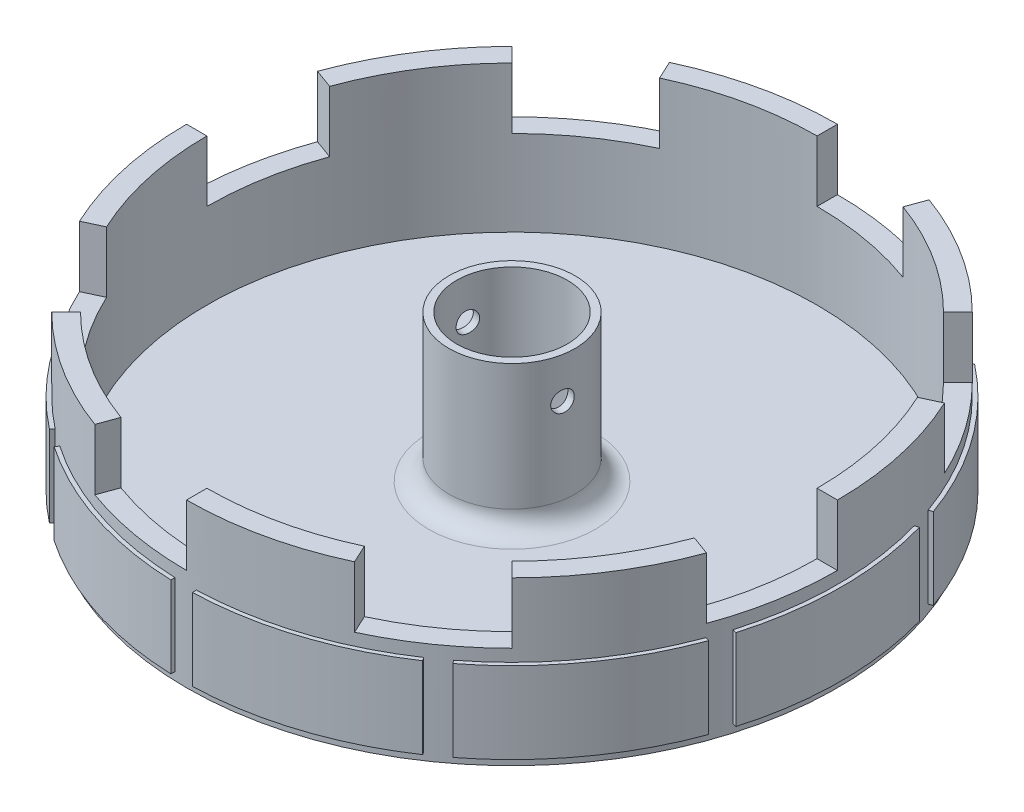
from build123d import *

# Parameters (mm, degrees)
SKETCH2_R           = 101.6
BOSS_EXTRUDE1_DEPTH = 50.8
SKETCH3_R           = 95.25
SKETCH3_R_2         = 19.685
CUT_EXTRUDE1_DEPTH  = 45.72
SKETCH4_R           = 17.272
CUT_EXTRUDE2_DEPTH  = 153.4
CUT_EXTRUDE3_START  = -19.05
CUT_EXTRUDE3_DEPTH  = 19.05
CIRPATTERN1_COUNT   = 8
WRAP1_START         = 2.54
WRAP1_DEPTH         = 25.4
CIRPATTERN2_COUNT   = 10
SKETCH9_R           = 3.175
CUT_EXTRUDE5_DEPTH  = 170.748495522
FILLET1_R           = 6.35


# Read off the part's stored shape, not the designer's step: Wrap1
with BuildPart() as part:
    # Sketch2 → Boss-Extrude1 (new body)
    with BuildSketch(Plane(origin=(0, 0, 0), x_dir=(1, 0, 0), z_dir=(0, 1, 0))):
        with Locations(Location((0, 0, 0), (0, 0, 270))):
            Circle(SKETCH2_R)
    extrude(amount=BOSS_EXTRUDE1_DEPTH)

    # Sketch3 → Cut-Extrude1 (cut)
    with BuildSketch(Plane(origin=(0, 50.8, 0), x_dir=(1, 0, 0), z_dir=(0, 1, 0))):
        with Locations(Location((0, 0, 0), (0, 0, 270))):
            Circle(SKETCH3_R)
        with Locations(Location((0, 0, 0), (0, 0, 270))):
            Circle(SKETCH3_R_2, mode=Mode.SUBTRACT)
    extrude(amount=-CUT_EXTRUDE1_DEPTH, mode=Mode.SUBTRACT)

    # Sketch4 → Cut-Extrude2 (cut, through all)
    with BuildSketch(Plane(origin=(0, 50.8, 0), x_dir=(1, 0, 0), z_dir=(0, 1, 0))):
        with Locations(Location((0, 0, 0), (0, 0, 270))):
            Circle(SKETCH4_R)
    extrude(amount=-CUT_EXTRUDE2_DEPTH, mode=Mode.SUBTRACT)

    # Sketch5 → Cut-Extrude3 (cut)
    with BuildSketch(Plane(origin=(0, 50.8, 0), x_dir=(1, 0, 0), z_dir=(0, 1, 0)).offset(CUT_EXTRUDE3_START)):
        with BuildLine():
            Line((0, 101.6), (0, 94.154505037))
            ThreePointArc((0, 94.154505037), (16.351324372, 92.723810373), (32.205726105, 88.475205707))
            Line((32.205726105, 88.475205707), (34.752471706, 95.471596354))
            ThreePointArc((34.752471706, 95.471596354), (17.644344851, 100.056169699), (0, 101.6))
        make_face()
    cut_extrude3 = extrude(amount=CUT_EXTRUDE3_DEPTH, mode=Mode.SUBTRACT)

    # CirPattern1: Cut-Extrude3 ×8 about axis
    cirpattern1_axis = Axis((0, 0, 0), (0, 1, 0))
    for i in range(1, CIRPATTERN1_COUNT):
        add(cut_extrude3.rotate(cirpattern1_axis, i * 360 / CIRPATTERN1_COUNT), mode=Mode.SUBTRACT)

    # Wrap1 outline → Wrap1 (add)
    with BuildSketch(Plane(origin=(0, 0, 0), x_dir=(1, 0, 0), z_dir=(0, 1, 0)).offset(WRAP1_START)):
        with BuildLine():
            ThreePointArc((98.742950455, -28.845565264), (102.869546579, -0.305428593), (98.912497991, 28.258709119))
            Line((98.912497991, 28.258709119), (97.691356041, 27.909836167))
            ThreePointArc((97.691356041, 27.909836167), (101.599552177, -0.30165787), (97.523901684, -28.489447175))
            Line((97.523901684, -28.489447175), (98.742950455, -28.845565264))
        make_face()
    wrap1 = extrude(amount=WRAP1_DEPTH)

    # CirPattern2: Wrap1 ×10 about axis
    cirpattern2_axis = Axis((0, 0, 0), (0, 1, 0))
    for i in range(1, CIRPATTERN2_COUNT):
        add(wrap1.rotate(cirpattern2_axis, i * 360 / CIRPATTERN2_COUNT))

    # Sketch9 → Cut-Extrude5 (cut, through all)
    with BuildSketch(Plane(origin=(19.385940618, 0, 3.418264377), x_dir=(0, 1, 0), z_dir=(0.9848077530122106, 0, 0.17364817766691706))):
        with Locations(Location((38.1, 0, 0), (0, 0, 270))):
            Circle(SKETCH9_R)
    extrude(amount=-CUT_EXTRUDE5_DEPTH, mode=Mode.SUBTRACT)

    # Fillet1
    fillet1_edges = [part.edges().sort_by_distance(p)[0] for p in [
        (0, 5.08, -19.685),
    ]]
    fillet(fillet1_edges, radius=FILLET1_R)


solid = part.part
